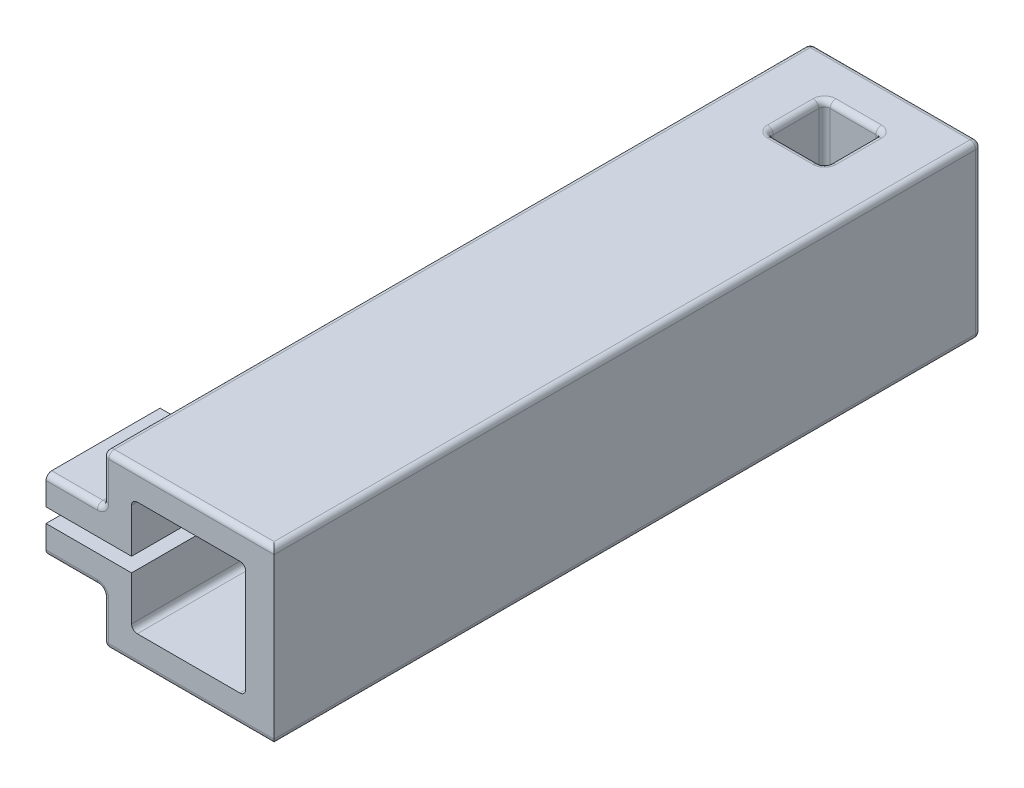
from build123d import *

# Parameters (mm, degrees)
BOSS_EXTRUDE1_DEPTH       = 25
SKETCH2_W                 = 25
SKETCH2_H                 = 2
BOSS_EXTRUDE2_DEPTH       = 10
CUT_EXTRUDE1_DEPTH        = 20
CUT_EXTRUDE2_DEPTH        = 20
CUT_EXTRUDE3_DEPTH        = 20
BOSS_EXTRUDE4_DEPTH       = 25
BOSS_EXTRUDE5_DEPTH       = 25
BOSS_EXTRUDE6_DEPTH       = 25
BOSS_EXTRUDE7_DEPTH       = 25
FILLET1_R                 = 1
FILLET2_R                 = 1
BOSS_EXTRUDE8_DEPTH       = 25
FILLET3_R                 = 1
BOSS_EXTRUDE9_DEPTH       = 100
CUT_EXTRUDE4_DEPTH        = 20
CUT_EXTRUDE5_DEPTH        = 23
SKETCH16_W                = 3.677966405
SKETCH16_H                = 25
CUT_EXTRUDE6_DEPTH        = 43
FILLET4_R                 = 1
SKETCH17_W                = 10
SKETCH17_H                = 10
CUT_EXTRUDE7_DEPTH        = 43
SKETCH18_W                = 10
SKETCH18_H                = 6.516373159
CUT_EXTRUDE8_DEPTH        = 104
FILLET5_R                 = 1
FILLET6_R                 = 1
CUT_EXTRUDE9_DEPTH        = 14
BOSS_EXTRUDE10_DEPTH      = 124
CUT_EXTRUDE10_DEPTH       = 124
SKETCH22_W                = 6
SKETCH22_H                = 1
BOSS_EXTRUDE11_DEPTH      = 20
FILLET7_R                 = 1
BOSS_EXTRUDE12_DEPTH      = 23
CUT_EXTRUDE14_DEPTH       = 43
SKETCH27_W                = 4.963344033
SKETCH27_H                = 2.516373159
BOSS_EXTRUDE13_DEPTH      = 23
SKETCH28_W                = 10
SKETCH28_H                = 5
CUT_EXTRUDE15_DEPTH       = 23
SKETCH29_W                = 15
SKETCH29_H                = 5
BOSS_EXTRUDE14_DEPTH      = 20
SKETCH31_W                = 10.401231949
SKETCH31_H                = 11.050215912
BOSS_EXTRUDE15_DEPTH      = 0.04
BOSS_EXTRUDE16_DEPTH      = 50.04
BOSS_EXTRUDE16_DEPTH_BACK = 10.04
SKETCH32_W                = 10
SKETCH32_H                = 10
SKETCH33_W                = 10
SKETCH33_H                = 20
CUT_EXTRUDE16_DEPTH       = 10
BOSS_EXTRUDE17_DEPTH      = 10
BOSS_EXTRUDE17_DEPTH_BACK = 10.0001
SKETCH34_W                = 10.401231949
SKETCH34_H                = 11.050215912
SKETCH35_W                = 10.401231949
SKETCH35_H                = 10
CUT_EXTRUDE17_DEPTH       = 20
SKETCH36_W                = 10
SKETCH36_H                = 5.04
CUT_EXTRUDE18_DEPTH       = 20
SKETCH37_W                = 11.280667341
SKETCH37_H                = 25.490916453
CUT_EXTRUDE19_DEPTH       = 30
FILLET8_R                 = 1
FILLET9_R                 = 1
SKETCH38_R                = 2
CUT_EXTRUDE20_DEPTH       = 20


# Some blends are built 0.0001 mm under size
with BuildPart() as part:
    # Sketch1 → Boss-Extrude1 (new body)
    with BuildSketch(Plane.XY):
        Polygon((-21.017028689, 4.503293201), (-21.017028689, 13.245106622), (-1.017028689, 13.245106622), (-1.017028689, -6.754893378), (-21.017028689, -6.754893378), (-21.017028689, 1.986920042), (-23.017028689, 1.986920042), (-23.017028689, -0.013079958), (-23.017028689, -8.754893378), (0.982971311, -8.754893378), (0.982971311, 15.245106622), (-23.017028689, 15.245106622), (-23.017028689, 6.503293201), (-23.017028689, 4.503293201), align=None)
    extrude(amount=BOSS_EXTRUDE1_DEPTH)

    # Sketch2 → Boss-Extrude2 (add)
    with BuildSketch(Plane.ZY.offset(23.017028689)):
        with Locations((12.5, 5.503293201)):
            Rectangle(SKETCH2_W, SKETCH2_H)
        with Locations((12.5, 0.986920042)):
            Rectangle(SKETCH2_W, SKETCH2_H)
    extrude(amount=BOSS_EXTRUDE2_DEPTH)

    # Sketch3 → Cut-Extrude1 (cut)
    with BuildSketch(Plane(origin=(0, 6.503293201, 0), x_dir=(1, 0, 0), z_dir=(0, 1, 0))):
        with BuildLine():
            ThreePointArc((-25.517028689, -12.5), (-25.946860613, -11.098427977), (-27.088551998, -10.178808273))
            Line((-27.088551998, -10.178808273), (-28.94550538, -14.821191727))
            ThreePointArc((-28.94550538, -14.821191727), (-26.615456665, -14.570168076), (-25.517028689, -12.5))
        make_face()
        with BuildLine():
            Line((-28.94550538, -14.821191727), (-27.088551998, -10.178808273))
            ThreePointArc((-27.088551998, -10.178808273), (-30.338220416, -11.571523309), (-28.94550538, -14.821191727))
        make_face()
    extrude(amount=-CUT_EXTRUDE1_DEPTH, mode=Mode.SUBTRACT)

    # Sketch4 → Cut-Extrude2 (cut)
    with BuildSketch(Plane(origin=(0, 6.503293201, 0), x_dir=(1, 0, 0), z_dir=(0, 1, 0))):
        with BuildLine():
            Line((-33.017028689, -24), (-33.017028689, -25))
            Line((-33.017028689, -25), (-32.017028689, -25))
            ThreePointArc((-32.017028689, -25), (-32.72413547, -24.707106781), (-33.017028689, -24))
        make_face()
    extrude(amount=-CUT_EXTRUDE2_DEPTH, mode=Mode.SUBTRACT)

    # Sketch5 → Cut-Extrude3 (cut)
    with BuildSketch(Plane(origin=(0, 6.503293201, 0), x_dir=(1, 0, 0), z_dir=(0, 1, 0))):
        with BuildLine():
            Line((-32.017028689, 0), (-33.017028689, 0))
            Line((-33.017028689, 0), (-33.017028689, -1))
            ThreePointArc((-33.017028689, -1), (-32.72413547, -0.292893219), (-32.017028689, 0))
        make_face()
    extrude(amount=-CUT_EXTRUDE3_DEPTH, mode=Mode.SUBTRACT)

    # Sketch6 → Boss-Extrude4 (add)
    with BuildSketch(Plane.XY.offset(25)):
        with BuildLine():
            Line((-20.017028689, 13.245106622), (-21.017028689, 13.245106622))
            Line((-21.017028689, 13.245106622), (-21.017028689, 12.245106622))
            ThreePointArc((-21.017028689, 12.245106622), (-20.72413547, 12.952213403), (-20.017028689, 13.245106622))
        make_face()
    extrude(amount=-BOSS_EXTRUDE4_DEPTH)

    # Sketch7 → Boss-Extrude5 (add)
    with BuildSketch(Plane.XY.offset(25)):
        with BuildLine():
            Line((-1.017028689, 12.245106622), (-1.017028689, 13.245106622))
            Line((-1.017028689, 13.245106622), (-2.017028689, 13.245106622))
            ThreePointArc((-2.017028689, 13.245106622), (-1.309921908, 12.952213403), (-1.017028689, 12.245106622))
        make_face()
    extrude(amount=-BOSS_EXTRUDE5_DEPTH)

    # Sketch9 → Boss-Extrude6 (add)
    with BuildSketch(Plane.XY.offset(25)):
        with BuildLine():
            Line((-2.017028689, -6.754893378), (-1.017028689, -6.754893378))
            Line((-1.017028689, -6.754893378), (-1.017028689, -5.754893378))
            ThreePointArc((-1.017028689, -5.754893378), (-1.309921908, -6.46200016), (-2.017028689, -6.754893378))
        make_face()
    extrude(amount=-BOSS_EXTRUDE6_DEPTH)

    # Sketch10 → Boss-Extrude7 (add)
    with BuildSketch(Plane.XY.offset(25)):
        with BuildLine():
            Line((-21.017028689, -5.754893378), (-21.017028689, -6.754893378))
            Line((-21.017028689, -6.754893378), (-20.017028689, -6.754893378))
            ThreePointArc((-20.017028689, -6.754893378), (-20.72413547, -6.46200016), (-21.017028689, -5.754893378))
        make_face()
    extrude(amount=-BOSS_EXTRUDE7_DEPTH)

    # Fillet1
    fillet1_edges = [part.edges().sort_by_distance(p)[0] for p in [
        (-23.017028689, 15.245106622, 12.5),
        (0.982971311, 15.245106622, 12.5),
        (0.982971311, -8.754893378, 12.5),
        (-23.017028689, -8.754893378, 12.5),
    ]]
    fillet(fillet1_edges, radius=FILLET1_R)

    # Fillet2
    fillet2_edges = [part.edges().sort_by_distance(p)[0] for p in [
        (-33.017028689, -0.013079958, 12.5),
        (-27.517028689, 6.503293201, 0),
        (-27.517028689, -0.013079958, 0),
        (-33.017028689, 6.503293201, 12.5),
        (-32.72413547, 6.503293201, 0.292893219),
        (-32.72413547, -0.013079958, 0.292893219),
        (-23.017028689, 10.374199911, 0),
        (-23.017028689, 10.374199911, 25),
        (-11.017028689, 15.245106622, 0),
        (0.982971311, 3.245106622, 0),
        (-11.017028689, -8.754893378, 0),
        (0.690078092, 14.952213403, 0),
        (0.690078092, -8.46200016, 0),
        (-22.72413547, -8.46200016, 0),
        (-22.72413547, 14.952213403, 0),
        (-11.017028689, 15.245106622, 25),
        (-11.017028689, -8.754893378, 25),
        (0.982971311, 3.245106622, 25),
        (0.690078092, 14.952213403, 25),
        (0.690078092, -8.46200016, 25),
        (-22.72413547, -8.46200016, 25),
        (-22.72413547, 14.952213403, 25),
        (-23.017028689, -3.883986668, 0),
        (-23.017028689, -3.883986668, 25),
        (-27.517028689, -0.013079958, 25),
        (-27.517028689, 6.503293201, 25),
        (-32.72413547, 6.503293201, 24.707106781),
        (-32.72413547, -0.013079958, 24.707106781),
    ]]
    fillet(fillet2_edges, radius=FILLET2_R)

    # Sketch11 → Boss-Extrude8 (add)
    with BuildSketch(Plane(origin=(0, 15.245106622, 0), x_dir=(1, 0, 0), z_dir=(0, 1, 0))):
        Polygon((-4.517028689, -6), (-17.234419993, -6), (-15.799637384, -7.5), (-6.017028689, -7.5), (-6.017028689, -17.5), (-6.234419993, -17.5), (-4.799637384, -19), (-4.517028689, -19), align=None)
        Polygon((-15.799637384, -7.5), (-17.234419993, -6), (-17.517028689, -6), (-17.517028689, -19), (-4.799637384, -19), (-6.234419993, -17.5), (-16.017028689, -17.5), (-16.017028689, -7.5), align=None)
    extrude(amount=BOSS_EXTRUDE8_DEPTH)

    # Fillet3
    fillet3_edges = [part.edges().sort_by_distance(p)[0] for p in [
        (-4.517028689, 27.745106622, 19),
        (-4.517028689, 27.745106622, 6),
        (-17.517028689, 27.745106622, 6),
        (-17.517028689, 27.745106622, 19),
    ]]
    fillet(fillet3_edges, radius=FILLET3_R)

    # Sketch12 → Boss-Extrude9 (add)
    with BuildSketch(Plane(origin=(0, 0, 1), x_dir=(-1, 0, 0), z_dir=(0, 0, -1))):
        with BuildLine():
            Line((0.017028689, 15.245106622), (22.017028689, 15.245106622))
            ThreePointArc((22.017028689, 15.245106622), (22.72413547, 14.952213403), (23.017028689, 14.245106622))
            Line((23.017028689, 14.245106622), (23.017028689, 6.503293201))
            Line((23.017028689, 6.503293201), (32.017028689, 6.503293201))
            ThreePointArc((32.017028689, 6.503293201), (32.72413547, 6.210399982), (33.017028689, 5.503293201))
            Line((33.017028689, 5.503293201), (33.017028689, 4.503293201))
            Line((33.017028689, 4.503293201), (21.017028689, 4.503293201))
            Line((21.017028689, 4.503293201), (21.017028689, 12.245106622))
            ThreePointArc((21.017028689, 12.245106622), (20.72413547, 12.952213403), (20.017028689, 13.245106622))
            Line((20.017028689, 13.245106622), (2.017028689, 13.245106622))
            ThreePointArc((2.017028689, 13.245106622), (1.309921908, 12.952213403), (1.017028689, 12.245106622))
            Line((1.017028689, 12.245106622), (1.017028689, -5.754893378))
            ThreePointArc((1.017028689, -5.754893378), (1.309921908, -6.46200016), (2.017028689, -6.754893378))
            Line((2.017028689, -6.754893378), (20.017028689, -6.754893378))
            ThreePointArc((20.017028689, -6.754893378), (20.72413547, -6.46200016), (21.017028689, -5.754893378))
            Line((21.017028689, -5.754893378), (21.017028689, 1.986920042))
            Line((21.017028689, 1.986920042), (32.017028689, 1.986920042))
            Line((32.017028689, 1.986920042), (33.017028689, 1.986920042))
            Line((33.017028689, 1.986920042), (33.017028689, 0.986920042))
            ThreePointArc((33.017028689, 0.986920042), (32.72413547, 0.279813261), (32.017028689, -0.013079958))
            Line((32.017028689, -0.013079958), (23.017028689, -0.013079958))
            Line((23.017028689, -0.013079958), (23.017028689, -7.754893378))
            ThreePointArc((23.017028689, -7.754893378), (22.72413547, -8.46200016), (22.017028689, -8.754893378))
            Line((22.017028689, -8.754893378), (0.017028689, -8.754893378))
            ThreePointArc((0.017028689, -8.754893378), (-0.690078092, -8.46200016), (-0.982971311, -7.754893378))
            Line((-0.982971311, -7.754893378), (-0.982971311, 14.245106622))
            ThreePointArc((-0.982971311, 14.245106622), (-0.690078092, 14.952213403), (0.017028689, 15.245106622))
        make_face()
    extrude(amount=BOSS_EXTRUDE9_DEPTH)

    # Sketch14 → Cut-Extrude4 (cut)
    with BuildSketch(Plane(origin=(0, 6.503293201, 0), x_dir=(1, 0, 0), z_dir=(0, 1, 0))):
        with BuildLine():
            ThreePointArc((-30.017028689, 68.84788668), (-27.517028689, 66.34788668), (-25.017028689, 68.84788668))
            Line((-25.017028689, 68.84788668), (-30.017028689, 68.84788668))
        make_face()
        with BuildLine():
            Line((-30.017028689, 68.84788668), (-25.017028689, 68.84788668))
            ThreePointArc((-25.017028689, 68.84788668), (-27.517028689, 71.34788668), (-30.017028689, 68.84788668))
        make_face()
        with BuildLine():
            ThreePointArc((-30.017028689, 29), (-27.517028689, 26.5), (-25.017028689, 29))
            Line((-25.017028689, 29), (-30.017028689, 29))
        make_face()
        with BuildLine():
            Line((-30.017028689, 29), (-25.017028689, 29))
            ThreePointArc((-25.017028689, 29), (-27.517028689, 31.5), (-30.017028689, 29))
        make_face()
    extrude(amount=-CUT_EXTRUDE4_DEPTH, mode=Mode.SUBTRACT)

    # Sketch15 → Cut-Extrude5 (cut)
    with BuildSketch(Plane(origin=(0, 15.245106622, 0), x_dir=(1, 0, 0), z_dir=(0, 1, 0))):
        Polygon((-16.017028689, -7.5), (-6.017028689, -17.5), (-6.017028689, -7.5), align=None)
        Polygon((-16.017028689, -7.5), (-6.017028689, -17.5), (-16.017028689, -17.5), align=None)
    extrude(amount=-CUT_EXTRUDE5_DEPTH, mode=Mode.SUBTRACT)

    # Sketch16 → Cut-Extrude6 (cut)
    with BuildSketch(Plane(origin=(-4.517028689, 0, 0), x_dir=(0, 0, -1), z_dir=(1, 0, 0))):
        Polygon((-18, 15.245106622), (-7, 40.245106622), (-18, 40.245106622), align=None)
        Polygon((-18, 15.245106622), (-7, 40.245106622), (-7, 15.245106622), align=None)
        with Locations((-5.161016798, 27.745106622)):
            Rectangle(SKETCH16_W, SKETCH16_H)
        with Locations((-19.838983203, 27.745106622)):
            Rectangle(SKETCH16_W, SKETCH16_H)
    extrude(amount=-CUT_EXTRUDE6_DEPTH, mode=Mode.SUBTRACT)

    # Fillet4
    fillet4_edges = [part.edges().sort_by_distance(p)[0] for p in [
        (0.690078092, 14.952213403, -99),
        (0.982971311, 3.245106622, -99),
        (0.690078092, -8.46200016, -99),
        (-11.017028689, -8.754893378, -99),
        (-22.72413547, -8.46200016, -99),
        (-23.017028689, -3.883986668, -99),
        (-27.517028689, -0.013079958, -99),
        (-32.72413547, 0.279813261, -99),
        (-33.017028689, 1.486920042, -99),
        (-21.017028689, -1.883986668, -99),
        (-20.72413547, -6.46200016, -99),
        (-11.017028689, -6.754893378, -99),
        (-1.309921908, -6.46200016, -99),
        (-1.017028689, 3.245106622, -99),
        (-1.309921908, 12.952213403, -99),
        (-11.017028689, 13.245106622, -99),
        (-20.72413547, 12.952213403, -99),
        (-21.017028689, 8.374199911, -99),
        (-33.017028689, 5.003293201, -99),
        (-32.72413547, 6.210399982, -99),
        (-27.517028689, 6.503293201, -99),
        (-23.017028689, 10.374199911, -99),
        (-22.72413547, 14.952213403, -99),
        (-11.017028689, 15.245106622, -99),
    ]]
    fillet(fillet4_edges, radius=FILLET4_R - 0.0001)  # a hair under: the kernel refuses the full size

    # Sketch17 → Cut-Extrude7 (cut)
    with BuildSketch(Plane(origin=(0, -7.754893378, 0), x_dir=(1, 0, 0), z_dir=(0, 1, 0))):
        with Locations((-11.017028689, -12.5)):
            Rectangle(SKETCH17_W, SKETCH17_H)
    extrude(amount=-CUT_EXTRUDE7_DEPTH, mode=Mode.SUBTRACT)

    # Sketch18 → Cut-Extrude8 (cut)
    with BuildSketch(Plane.XY.offset(25)):
        with Locations((-28.017028689, 3.245106622)):
            Rectangle(SKETCH18_W, SKETCH18_H)
    extrude(amount=-CUT_EXTRUDE8_DEPTH, mode=Mode.SUBTRACT)

    # Fillet5
    fillet5_edges = [part.edges().sort_by_distance(p)[0] for p in [
        (-23.017028689, 1.486920042, 25),
        (-23.017028689, 5.003293201, 25),
    ]]
    fillet(fillet5_edges, radius=FILLET5_R - 0.0001)  # a hair under: the kernel refuses the full size

    # Fillet6
    fillet6_edges = [part.edges().sort_by_distance(p)[0] for p in [
        (-32.72413547, 6.210399982, -79),
        (-33.017028689, 1.486920042, -79),
        (-27.517028689, -0.013079958, -79),
        (-32.72413547, 0.279813261, -79),
        (-27.517028689, 6.503293201, -79),
        (-33.017028689, 5.003293201, -79),
    ]]
    fillet(fillet6_edges, radius=FILLET6_R)

    # Sketch19 → Cut-Extrude9 (cut)
    with BuildSketch(Plane(origin=(0, 6.503293201, 0), x_dir=(1, 0, 0), z_dir=(0, 1, 0))):
        with BuildLine():
            ThreePointArc((-26.3989947, 91.236067977), (-27.517028689, 91.5), (-28.635062677, 91.236067977))
            Line((-28.635062677, 91.236067977), (-27.517028689, 89))
            Line((-27.517028689, 89), (-26.3989947, 91.236067977))
        make_face()
        with BuildLine():
            Line((-27.517028689, 89), (-28.635062677, 91.236067977))
            ThreePointArc((-28.635062677, 91.236067977), (-30.017028689, 89), (-28.635062677, 86.763932023))
            Line((-28.635062677, 86.763932023), (-27.517028689, 89))
        make_face()
        with BuildLine():
            Line((-26.3989947, 91.236067977), (-27.517028689, 89))
            Line((-27.517028689, 89), (-26.3989947, 86.763932023))
            ThreePointArc((-26.3989947, 86.763932023), (-25.390401668, 87.68567222), (-25.017028689, 89))
            ThreePointArc((-25.017028689, 89), (-25.390401668, 90.31432778), (-26.3989947, 91.236067977))
        make_face()
        with BuildLine():
            Line((-26.3989947, 86.763932023), (-27.517028689, 89))
            Line((-27.517028689, 89), (-28.635062677, 86.763932023))
            ThreePointArc((-28.635062677, 86.763932023), (-27.517028689, 86.5), (-26.3989947, 86.763932023))
        make_face()
    extrude(amount=-CUT_EXTRUDE9_DEPTH, mode=Mode.SUBTRACT)

    # Sketch20 → Boss-Extrude10 (add)
    with BuildSketch(Plane(origin=(0, 0, -99), x_dir=(-1, 0, 0), z_dir=(0, 0, -1))):
        Polygon((21.053684656, -6.791549346), (0.980372721, -6.791549346), (0.980372721, 13.281762589), (21.053684656, 13.281762589), (21.053684656, 4.503293201), (26.017028689, 4.503293201), (26.017028689, 18.245106622), (-3.982971311, 18.245106622), (-3.982971311, -11.754893378), (26.017028689, -11.754893378), (26.017028689, 1.986920042), (21.053684656, 1.986920042), align=None)
    extrude(amount=-BOSS_EXTRUDE10_DEPTH)

    # Sketch21 → Cut-Extrude10 (cut)
    with BuildSketch(Plane(origin=(0, -11.754893378, 0), x_dir=(-1, 0, 0), z_dir=(0, -1, 0))):
        Polygon((6.017028689, 91.5), (11.017028689, 91.5), (16.017028689, 91.5), (16.017028689, 81.5), (6.017028689, 81.5), align=None)
    extrude(amount=-CUT_EXTRUDE10_DEPTH, mode=Mode.SUBTRACT)

    # Sketch22 → Boss-Extrude11 (add)
    with BuildSketch(Plane(origin=(0, 0, -99), x_dir=(-1, 0, 0), z_dir=(0, 0, -1))):
        with Locations((29.017028689, 1.486920042)):
            Rectangle(SKETCH22_W, SKETCH22_H)
        Polygon((36.017028689, 1.986920042), (32.017028689, 1.986920042), (32.017028689, 0.986920042), (26.017028689, 0.986920042), (26.017028689, -3.013079958), (36.017028689, -3.013079958), align=None)
        with Locations((29.017028689, 5.003293201)):
            Rectangle(SKETCH22_W, SKETCH22_H)
        Polygon((32.017028689, 5.503293201), (32.017028689, 4.503293201), (36.017028689, 4.503293201), (36.017028689, 9.503293201), (26.017028689, 9.503293201), (26.017028689, 5.503293201), align=None)
    extrude(amount=-BOSS_EXTRUDE11_DEPTH)

    # Fillet7
    fillet7_edges = [part.edges().sort_by_distance(p)[0] for p in [
        (-11.017028689, -11.754893378, -99),
        (-11.017028689, -11.754893378, 25),
        (-26.017028689, -11.754893378, -37),
        (3.982971311, -11.754893378, -37),
        (-11.017028689, 18.245106622, -99),
        (3.982971311, 18.245106622, -37),
        (-26.017028689, 18.245106622, -37),
        (-11.017028689, 18.245106622, 25),
    ]]
    fillet(fillet7_edges, radius=FILLET7_R)

    # Sketch25 → Boss-Extrude12 (add)
    with BuildSketch(Plane(origin=(0, 0, -99), x_dir=(-1, 0, 0), z_dir=(0, 0, -1))):
        Polygon((0.980372721, 12.612652191), (0.980372721, -6.122438948), (11.017028689, 3.245106622), align=None)
        Polygon((0.980372721, 12.612652191), (11.017028689, 3.245106622), (21.053684656, 12.612652191), (21.053684656, 13.281762589), (0.980372721, 13.281762589), align=None)
        Polygon((21.053684656, 12.612652191), (11.017028689, 3.245106622), (21.053684656, -6.122438948), (21.053684656, 1.986920042), (21.053684656, 4.503293201), align=None)
        Polygon((11.017028689, 3.245106622), (0.980372721, -6.122438948), (0.980372721, -6.791549346), (21.053684656, -6.791549346), (21.053684656, -6.122438948), align=None)
    extrude(amount=-BOSS_EXTRUDE12_DEPTH)

    # Sketch26 → Cut-Extrude14 (cut)
    with BuildSketch(Plane(origin=(0, 13.281762589, 0), x_dir=(1, 0, 0), z_dir=(0, 1, 0))):
        Polygon((-11.017028689, 86.5), (-6.017028689, 81.5), (-6.017028689, 91.5), align=None)
        Polygon((-16.017028689, 81.5), (-6.017028689, 81.5), (-11.017028689, 86.5), align=None)
        Polygon((-16.017028689, 81.5), (-11.017028689, 86.5), (-16.017028689, 91.5), align=None)
        Polygon((-16.017028689, 91.5), (-11.017028689, 86.5), (-6.017028689, 91.5), align=None)
    extrude(amount=-CUT_EXTRUDE14_DEPTH, mode=Mode.SUBTRACT)

    # Sketch27 → Boss-Extrude13 (add)
    with BuildSketch(Plane(origin=(0, 0, -99), x_dir=(-1, 0, 0), z_dir=(0, 0, -1))):
        with Locations((23.535356673, 3.245106622)):
            Rectangle(SKETCH27_W, SKETCH27_H)
    extrude(amount=-BOSS_EXTRUDE13_DEPTH)

    # Sketch28 → Cut-Extrude15 (cut)
    with BuildSketch(Plane.XY.offset(-79)):
        with Locations((-31.017028689, 7.003293201)):
            Rectangle(SKETCH28_W, SKETCH28_H)
        with Locations((-31.017028689, -0.513079958)):
            Rectangle(SKETCH28_W, SKETCH28_H)
    extrude(amount=-CUT_EXTRUDE15_DEPTH, mode=Mode.SUBTRACT)

    # Sketch29 → Boss-Extrude14 (add)
    with BuildSketch(Plane.XY.offset(25)):
        with Locations((-28.517028689, 7.003293201)):
            Rectangle(SKETCH29_W, SKETCH29_H)
        with Locations((-28.517028689, -0.513079958)):
            Rectangle(SKETCH29_W, SKETCH29_H)
    extrude(amount=-BOSS_EXTRUDE14_DEPTH)

    # Sketch31 → Boss-Extrude15 (add)
    with BuildSketch(Plane(origin=(0, 13.281762589, 0), x_dir=(-1, 0, 0), z_dir=(0, -1, 0))):
        with Locations((10.816412715, -11.974892044)):
            Rectangle(SKETCH31_W, SKETCH31_H)
    extrude(amount=BOSS_EXTRUDE15_DEPTH)

    # Sketch32 → Boss-Extrude16 (add, two sides: drawn at the far end of the back side and taken through both)
    with BuildSketch(Plane(origin=(0, -6.754893378, 0), x_dir=(1, 0, 0), z_dir=(0, 1, 0)).offset(-BOSS_EXTRUDE16_DEPTH_BACK)):
        with Locations((-11.017028689, -12.5)):
            Rectangle(SKETCH32_W, SKETCH32_H)
    extrude(amount=BOSS_EXTRUDE16_DEPTH + BOSS_EXTRUDE16_DEPTH_BACK)

    # Sketch33 → Cut-Extrude16 (cut)
    with BuildSketch(Plane.XY.offset(17.5)):
        with Locations((-11.017028689, 3.245106622)):
            Rectangle(SKETCH33_W, SKETCH33_H)
    extrude(amount=-CUT_EXTRUDE16_DEPTH, mode=Mode.SUBTRACT)

    # Sketch34 → Boss-Extrude17 (add, two sides: drawn at the far end of the back side and taken through both)
    with BuildSketch(Plane(origin=(0, 13.245106622, 0), x_dir=(-1, 0, 0), z_dir=(0, -1, 0)).offset(-BOSS_EXTRUDE17_DEPTH_BACK)):
        with Locations((10.816412715, -11.974892044)):
            Rectangle(SKETCH34_W, SKETCH34_H)
    extrude(amount=BOSS_EXTRUDE17_DEPTH + BOSS_EXTRUDE17_DEPTH_BACK)

    # Sketch35 → Cut-Extrude17 (cut)
    with BuildSketch(Plane.XY.offset(17.5)):
        with Locations((-10.816412715, 8.245106622)):
            Rectangle(SKETCH35_W, SKETCH35_H)
    extrude(amount=-CUT_EXTRUDE17_DEPTH, mode=Mode.SUBTRACT)

    # Sketch36 → Cut-Extrude18 (cut)
    with BuildSketch(Plane.XY.offset(17.5)):
        with Locations((-11.017028689, -14.274893378)):
            Rectangle(SKETCH36_W, SKETCH36_H)
    extrude(amount=-CUT_EXTRUDE18_DEPTH, mode=Mode.SUBTRACT)

    # Sketch37 → Cut-Extrude19 (cut)
    with BuildSketch(Plane.XY.offset(17.5)):
        with Locations((-10.376695018, 30.990564849)):
            Rectangle(SKETCH37_W, SKETCH37_H)
    extrude(amount=-CUT_EXTRUDE19_DEPTH, mode=Mode.SUBTRACT)

    # Fillet8
    # the kernel refuses this fillet: 1 mm, written as the material it adds along each edge
    with BuildSketch(Plane(origin=(-26.017028689, 9.503293201, 5), x_dir=(0, 0, -1), z_dir=(0, -1, 0))) as fillet8_piece_1:
        with BuildLine():
            CenterArc((FILLET8_R, -FILLET8_R), FILLET8_R, 90, 90)
            Line((0, -FILLET8_R), (0, 0))
            Line((0, 0), (FILLET8_R, 0))
        make_face()
    extrude(amount=5)
    with BuildSketch(Plane(origin=(-26.017028689, 9.503293201, 5), x_dir=(0, 1, 0), z_dir=(0, 0, 1))) as fillet8_piece_2:
        with BuildLine():
            CenterArc((FILLET8_R, FILLET8_R), FILLET8_R, 180, 90)
            Line((0, FILLET8_R), (0, 0))
            Line((0, 0), (FILLET8_R, 0))
        make_face()
    extrude(amount=20)
    with BuildSketch(Plane(origin=(-26.017028689, -3.013079958, 5), x_dir=(0, 0, -1), z_dir=(0, 1, 0))) as fillet8_piece_3:
        with BuildLine():
            CenterArc((FILLET8_R, FILLET8_R), FILLET8_R, 180, 90)
            Line((0, FILLET8_R), (0, 0))
            Line((0, 0), (FILLET8_R, 0))
        make_face()
    extrude(amount=5)
    with BuildSketch(Plane(origin=(-26.017028689, -3.013079958, 5), x_dir=(0, -1, 0), z_dir=(0, 0, 1))) as fillet8_piece_4:
        with BuildLine():
            CenterArc((FILLET8_R, -FILLET8_R), FILLET8_R, 90, 90)
            Line((0, -FILLET8_R), (0, 0))
            Line((0, 0), (FILLET8_R, 0))
        make_face()
    extrude(amount=20)
    with BuildSketch(Plane(origin=(-26.017028689, 9.503293201, 2.5), x_dir=(0, 1, 0), z_dir=(0, 0, 1))) as fillet8_piece_5a_section:
        with BuildLine():
            CenterArc((FILLET8_R, FILLET8_R), FILLET8_R, 180, 90)
            Line((0, FILLET8_R), (0, 0))
            Line((0, 0), (FILLET8_R, 0))
        make_face()
    fillet8_piece_5a = extrude(amount=22.5, mode=Mode.PRIVATE)
    fillet8_piece_5a = split(fillet8_piece_5a, bisect_by=Plane(origin=(-26.243423803, 9.729688315, 5), z_dir=(0, 0, -1)), keep=Keep.TOP, mode=Mode.PRIVATE)
    with BuildSketch(Plane(origin=(-26.017028689, 12.003293201, 5), x_dir=(0, 0, -1), z_dir=(0, -1, 0))) as fillet8_piece_5b_section:
        with BuildLine():
            CenterArc((FILLET8_R, -FILLET8_R), FILLET8_R, 90, 90)
            Line((0, -FILLET8_R), (0, 0))
            Line((0, 0), (FILLET8_R, 0))
        make_face()
    fillet8_piece_5b = extrude(amount=7.5, mode=Mode.PRIVATE)
    fillet8_piece_5b = split(fillet8_piece_5b, bisect_by=Plane(origin=(-26.243423803, 9.503293201, 4.773604886), z_dir=(0, 1, 0)), keep=Keep.TOP, mode=Mode.PRIVATE)
    fillet8_piece_5 = fillet8_piece_5a & fillet8_piece_5b
    add(fillet8_piece_5)
    with BuildSketch(Plane(origin=(-26.017028689, -5.513079958, 5), x_dir=(0, 0, -1), z_dir=(0, 1, 0))) as fillet8_piece_6a_section:
        with BuildLine():
            CenterArc((FILLET8_R, FILLET8_R), FILLET8_R, 180, 90)
            Line((0, FILLET8_R), (0, 0))
            Line((0, 0), (FILLET8_R, 0))
        make_face()
    fillet8_piece_6a = extrude(amount=7.5, mode=Mode.PRIVATE)
    fillet8_piece_6a = split(fillet8_piece_6a, bisect_by=Plane(origin=(-26.243423803, -3.013079958, 4.773604886), z_dir=(0, -1, 0)), keep=Keep.TOP, mode=Mode.PRIVATE)
    with BuildSketch(Plane(origin=(-26.017028689, -3.013079958, 2.5), x_dir=(0, -1, 0), z_dir=(0, 0, 1))) as fillet8_piece_6b_section:
        with BuildLine():
            CenterArc((FILLET8_R, -FILLET8_R), FILLET8_R, 90, 90)
            Line((0, -FILLET8_R), (0, 0))
            Line((0, 0), (FILLET8_R, 0))
        make_face()
    fillet8_piece_6b = extrude(amount=22.5, mode=Mode.PRIVATE)
    fillet8_piece_6b = split(fillet8_piece_6b, bisect_by=Plane(origin=(-26.243423803, -3.239475072, 5), z_dir=(0, 0, -1)), keep=Keep.TOP, mode=Mode.PRIVATE)
    fillet8_piece_6 = fillet8_piece_6a & fillet8_piece_6b
    add(fillet8_piece_6)
    # the kernel refuses this fillet: 1 mm, written as the material it takes off along each edge
    with BuildSketch(Plane(origin=(-25.017028689, 17.245106622, 24), x_dir=(-1, 0, 0), z_dir=(0, 0, 1))) as fillet8_2_piece_1_section:
        Polygon((0, 0), (FILLET8_R, 0), (FILLET8_R, -FILLET8_R), (0, -FILLET8_R), align=None)
    fillet8_2_piece_1 = extrude(amount=FILLET8_R, mode=Mode.PRIVATE)
    fillet8_2_piece_1 = fillet8_2_piece_1 - Plane(origin=(-25.017028689, 17.245106622, 24), x_dir=(0.7071067811865475, -0.7071067811865475, 0), z_dir=(0, 0, 1)) * Sphere(FILLET8_R, mode=Mode.PRIVATE)
    add(fillet8_2_piece_1, mode=Mode.SUBTRACT)
    with BuildSketch(Plane(origin=(-25.017028689, 17.245106622, -98), x_dir=(-1, 0, 0), z_dir=(0, 0, -1))) as fillet8_2_piece_2_section:
        Polygon((0, 0), (FILLET8_R, 0), (FILLET8_R, FILLET8_R), (0, FILLET8_R), align=None)
    fillet8_2_piece_2 = extrude(amount=FILLET8_R, mode=Mode.PRIVATE)
    fillet8_2_piece_2 = fillet8_2_piece_2 - Plane(origin=(-25.017028689, 17.245106622, -98), x_dir=(0.7071067811865475, -0.7071067811865475, 0), z_dir=(0, 0, -1)) * Sphere(FILLET8_R, mode=Mode.PRIVATE)
    add(fillet8_2_piece_2, mode=Mode.SUBTRACT)
    with BuildSketch(Plane(origin=(2.982971311, 17.245106622, -98), x_dir=(1, 0, 0), z_dir=(0, 0, -1))) as fillet8_2_piece_3_section:
        Polygon((0, 0), (FILLET8_R, 0), (FILLET8_R, -FILLET8_R), (0, -FILLET8_R), align=None)
    fillet8_2_piece_3 = extrude(amount=FILLET8_R, mode=Mode.PRIVATE)
    fillet8_2_piece_3 = fillet8_2_piece_3 - Plane(origin=(2.982971311, 17.245106622, -98), x_dir=(-0.7071067811865475, -0.7071067811865475, 0), z_dir=(0, 0, -1)) * Sphere(FILLET8_R, mode=Mode.PRIVATE)
    add(fillet8_2_piece_3, mode=Mode.SUBTRACT)
    with BuildSketch(Plane(origin=(2.982971311, -10.754893378, -98), x_dir=(1, 0, 0), z_dir=(0, 0, -1))) as fillet8_2_piece_4_section:
        Polygon((0, 0), (FILLET8_R, 0), (FILLET8_R, FILLET8_R), (0, FILLET8_R), align=None)
    fillet8_2_piece_4 = extrude(amount=FILLET8_R, mode=Mode.PRIVATE)
    fillet8_2_piece_4 = fillet8_2_piece_4 - Plane(origin=(2.982971311, -10.754893378, -98), x_dir=(-0.7071067811865475, 0.7071067811865475, 0), z_dir=(0, 0, -1)) * Sphere(FILLET8_R, mode=Mode.PRIVATE)
    add(fillet8_2_piece_4, mode=Mode.SUBTRACT)
    with BuildSketch(Plane(origin=(-25.017028689, -10.754893378, -98), x_dir=(-1, 0, 0), z_dir=(0, 0, -1))) as fillet8_2_piece_5_section:
        Polygon((0, 0), (FILLET8_R, 0), (FILLET8_R, -FILLET8_R), (0, -FILLET8_R), align=None)
    fillet8_2_piece_5 = extrude(amount=FILLET8_R, mode=Mode.PRIVATE)
    fillet8_2_piece_5 = fillet8_2_piece_5 - Plane(origin=(-25.017028689, -10.754893378, -98), x_dir=(0.7071067811865475, 0.7071067811865475, 0), z_dir=(0, 0, -1)) * Sphere(FILLET8_R, mode=Mode.PRIVATE)
    add(fillet8_2_piece_5, mode=Mode.SUBTRACT)
    with BuildSketch(Plane(origin=(-25.017028689, -10.754893378, 24), x_dir=(-1, 0, 0), z_dir=(0, 0, 1))) as fillet8_2_piece_6_section:
        Polygon((0, 0), (FILLET8_R, 0), (FILLET8_R, FILLET8_R), (0, FILLET8_R), align=None)
    fillet8_2_piece_6 = extrude(amount=FILLET8_R, mode=Mode.PRIVATE)
    fillet8_2_piece_6 = fillet8_2_piece_6 - Plane(origin=(-25.017028689, -10.754893378, 24), x_dir=(0.7071067811865475, 0.7071067811865475, 0), z_dir=(0, 0, 1)) * Sphere(FILLET8_R, mode=Mode.PRIVATE)
    add(fillet8_2_piece_6, mode=Mode.SUBTRACT)
    with BuildSketch(Plane(origin=(-26.017028689, 1.986920042, -76), x_dir=(1, 0, 0), z_dir=(0, 1, 0))) as fillet8_2_piece_7:
        with BuildLine():
            CenterArc((FILLET8_R, FILLET8_R), FILLET8_R, 180, 90)
            Line((0, FILLET8_R), (0, 0))
            Line((0, 0), (FILLET8_R, 0))
        make_face()
    extrude(amount=2.516373158, mode=Mode.SUBTRACT)
    with BuildSketch(Plane(origin=(-26.017028689, 10.503293201, 25), x_dir=(1, 0, 0), z_dir=(0, 1, 0)), Plane(origin=(-26.017028689, -10.754893378, 25), x_dir=(1, 0, 0), z_dir=(0, 1, 0))) as fillet8_2_piece_8:
        with BuildLine():
            CenterArc((FILLET8_R, FILLET8_R), FILLET8_R, 180, 90)
            Line((0, FILLET8_R), (0, 0))
            Line((0, 0), (FILLET8_R, 0))
        make_face()
    extrude(amount=6.741813421, mode=Mode.SUBTRACT)
    with BuildSketch(Plane(origin=(-26.017028689, 4.503293201, -76), x_dir=(1, 0, 0), z_dir=(0, 0, 1))) as fillet8_2_piece_9:
        with BuildLine():
            CenterArc((FILLET8_R, FILLET8_R), FILLET8_R, 180, 90)
            Line((0, FILLET8_R), (0, 0))
            Line((0, 0), (FILLET8_R, 0))
        make_face()
    extrude(amount=80, mode=Mode.SUBTRACT)
    with BuildSketch(Plane(origin=(-27.017028689, 4.503293201, 5), x_dir=(0, 0, 1), z_dir=(-1, 0, 0)), Plane(origin=(-38.517028689, 9.503293201, 25), x_dir=(0, -1, 0), z_dir=(1, 0, 0)), Plane(origin=(-27.017028689, 1.986920042, 5), x_dir=(0, -1, 0), z_dir=(-1, 0, 0))) as fillet8_2_piece_10:
        with BuildLine():
            CenterArc((FILLET8_R, FILLET8_R), FILLET8_R, 180, 90)
            Line((0, FILLET8_R), (0, 0))
            Line((0, 0), (FILLET8_R, 0))
        make_face()
    extrude(amount=11.5, mode=Mode.SUBTRACT)
    with BuildSketch(Plane(origin=(-26.017028689, 1.986920042, -76), x_dir=(1, 0, 0), z_dir=(0, 0, 1))) as fillet8_2_piece_11:
        with BuildLine():
            CenterArc((FILLET8_R, -FILLET8_R), FILLET8_R, 90, 90)
            Line((0, -FILLET8_R), (0, 0))
            Line((0, 0), (FILLET8_R, 0))
        make_face()
    extrude(amount=80, mode=Mode.SUBTRACT)
    with BuildSketch(Plane(origin=(-38.517028689, -3.013079958, 25), x_dir=(0, 1, 0), z_dir=(1, 0, 0))) as fillet8_2_piece_12:
        with BuildLine():
            CenterArc((FILLET8_R, -FILLET8_R), FILLET8_R, 90, 90)
            Line((0, -FILLET8_R), (0, 0))
            Line((0, 0), (FILLET8_R, 0))
        make_face()
    extrude(amount=11.5, mode=Mode.SUBTRACT)
    with BuildSketch(Plane(origin=(-26.017028689, -10.754893378, -99), x_dir=(1, 0, 0), z_dir=(0, 1, 0)), Plane(origin=(3.982971311, 17.245106622, -99), x_dir=(-1, 0, 0), z_dir=(0, -1, 0))) as fillet8_2_piece_13:
        with BuildLine():
            CenterArc((FILLET8_R, -FILLET8_R), FILLET8_R, 90, 90)
            Line((0, -FILLET8_R), (0, 0))
            Line((0, 0), (FILLET8_R, 0))
        make_face()
    extrude(amount=28, mode=Mode.SUBTRACT)
    with BuildSketch(Plane(origin=(-27.017028689, -4.013079958, 25), x_dir=(1, 0, 0), z_dir=(0, -1, 0))) as fillet8_2_piece_14:
        with BuildLine():
            CenterArc((1 + FILLET8_R, -FILLET8_R), FILLET8_R, 90, 90)
            Line((1, -FILLET8_R), (1, 0))
            Line((1, 0), (1 + FILLET8_R, 0))
        make_face()
    revolve(axis=Axis((-27.017028689, -4.013079958, 25), (0, 0, 1)), revolution_arc=90, mode=Mode.SUBTRACT)
    with BuildSketch(Plane(origin=(-27.017028689, 1.986920042, 4), x_dir=(1, 0, 0), z_dir=(0, 0, -1))) as fillet8_2_piece_15:
        with BuildLine():
            CenterArc((1 + FILLET8_R, FILLET8_R), FILLET8_R, 180, 90)
            Line((1 + FILLET8_R, 0), (1, 0))
            Line((1, 0), (1, FILLET8_R))
        make_face()
    revolve(axis=Axis((-27.017028689, 1.986920042, 4), (0, -1, 0)), revolution_arc=90, mode=Mode.SUBTRACT)
    with BuildSketch(Plane(origin=(-27.017028689, 10.503293201, 25), x_dir=(1, 0, 0), z_dir=(0, 1, 0))) as fillet8_2_piece_16:
        with BuildLine():
            CenterArc((1 + FILLET8_R, FILLET8_R), FILLET8_R, 180, 90)
            Line((1, FILLET8_R), (1, 0))
            Line((1, 0), (1 + FILLET8_R, 0))
        make_face()
    revolve(axis=Axis((-27.017028689, 10.503293201, 25), (0, 0, -1)), revolution_arc=90, mode=Mode.SUBTRACT)
    with BuildSketch(Plane(origin=(-27.017028689, 4.503293201, 4), x_dir=(1, 0, 0), z_dir=(0, 0, -1))) as fillet8_2_piece_17:
        with BuildLine():
            CenterArc((1 + FILLET8_R, -FILLET8_R), FILLET8_R, 90, 90)
            Line((1, -FILLET8_R), (1, 0))
            Line((1, 0), (1 + FILLET8_R, 0))
        make_face()
    revolve(axis=Axis((-27.017028689, 4.503293201, 4), (0, -1, 0)), revolution_arc=90, mode=Mode.SUBTRACT)
    with BuildSketch(Plane(origin=(-26.017028689, 1.986920042, -78.5), x_dir=(1, 0, 0), z_dir=(0, 0, 1))) as fillet8_2_piece_18a_section:
        with BuildLine():
            CenterArc((FILLET8_R, -FILLET8_R), FILLET8_R, 90, 90)
            Line((0, -FILLET8_R), (0, 0))
            Line((0, 0), (FILLET8_R, 0))
        make_face()
    fillet8_2_piece_18a = extrude(amount=82.5, mode=Mode.PRIVATE)
    fillet8_2_piece_18a = split(fillet8_2_piece_18a, bisect_by=Plane(origin=(-25.790633574, 1.760524928, -76), z_dir=(0, 0, -1)), keep=Keep.TOP, mode=Mode.PRIVATE)
    with BuildSketch(Plane(origin=(-26.017028689, -0.513079958, -76), x_dir=(1, 0, 0), z_dir=(0, 1, 0))) as fillet8_2_piece_18b_section:
        with BuildLine():
            CenterArc((FILLET8_R, FILLET8_R), FILLET8_R, 180, 90)
            Line((0, FILLET8_R), (0, 0))
            Line((0, 0), (FILLET8_R, 0))
        make_face()
    fillet8_2_piece_18b = extrude(amount=5.016373158, mode=Mode.PRIVATE)
    fillet8_2_piece_18b = split(fillet8_2_piece_18b, bisect_by=Plane(origin=(-25.790633574, 1.986920042, -76.226395114), z_dir=(0, -1, 0)), keep=Keep.TOP, mode=Mode.PRIVATE)
    fillet8_2_piece_18 = fillet8_2_piece_18a & fillet8_2_piece_18b
    add(fillet8_2_piece_18, mode=Mode.SUBTRACT)
    with BuildSketch(Plane(origin=(-26.017028689, 1.986920042, -76), x_dir=(1, 0, 0), z_dir=(0, 1, 0))) as fillet8_2_piece_19a_section:
        with BuildLine():
            CenterArc((FILLET8_R, FILLET8_R), FILLET8_R, 180, 90)
            Line((0, FILLET8_R), (0, 0))
            Line((0, 0), (FILLET8_R, 0))
        make_face()
    fillet8_2_piece_19a = extrude(amount=5.016373158, mode=Mode.PRIVATE)
    fillet8_2_piece_19a = split(fillet8_2_piece_19a, bisect_by=Plane(origin=(-25.790633574, 4.503293201, -76.226395114), z_dir=(0, 1, 0)), keep=Keep.TOP, mode=Mode.PRIVATE)
    with BuildSketch(Plane(origin=(-26.017028689, 4.503293201, -78.5), x_dir=(1, 0, 0), z_dir=(0, 0, 1))) as fillet8_2_piece_19b_section:
        with BuildLine():
            CenterArc((FILLET8_R, FILLET8_R), FILLET8_R, 180, 90)
            Line((0, FILLET8_R), (0, 0))
            Line((0, 0), (FILLET8_R, 0))
        make_face()
    fillet8_2_piece_19b = extrude(amount=82.5, mode=Mode.PRIVATE)
    fillet8_2_piece_19b = split(fillet8_2_piece_19b, bisect_by=Plane(origin=(-25.790633574, 4.729688315, -76), z_dir=(0, 0, -1)), keep=Keep.TOP, mode=Mode.PRIVATE)
    fillet8_2_piece_19 = fillet8_2_piece_19a & fillet8_2_piece_19b
    add(fillet8_2_piece_19, mode=Mode.SUBTRACT)

    # Fillet9
    fillet9_edges = [part.edges().sort_by_distance(p)[0] for p in [
        (-6.017028689, 3.245106622, -91.5),
        (-11.017028689, 18.245106622, -91.5),
        (-16.017028689, 3.245106622, -91.5),
        (-16.017028689, 18.245106622, -86.5),
        (-16.017028689, 3.245106622, -81.5),
        (-11.017028689, 18.245106622, -81.5),
        (-6.017028689, 3.245106622, -81.5),
        (-6.017028689, 18.245106622, -86.5),
        (-11.017028689, -11.754893378, -91.5),
        (-16.017028689, -11.754893378, -86.5),
        (-11.017028689, -11.754893378, -81.5),
        (-6.017028689, -11.754893378, -86.5),
    ]]
    fillet(fillet9_edges, radius=FILLET9_R)

    # Sketch38 → Cut-Extrude20 (cut)
    with BuildSketch(Plane(origin=(0, 9.503293201, 0), x_dir=(1, 0, 0), z_dir=(0, 1, 0))):
        with Locations(Location((-31.017028689, -14.5, 0), (0, 0, 270))):
            Circle(SKETCH38_R)
    extrude(amount=-CUT_EXTRUDE20_DEPTH, mode=Mode.SUBTRACT)


solid = part.part
